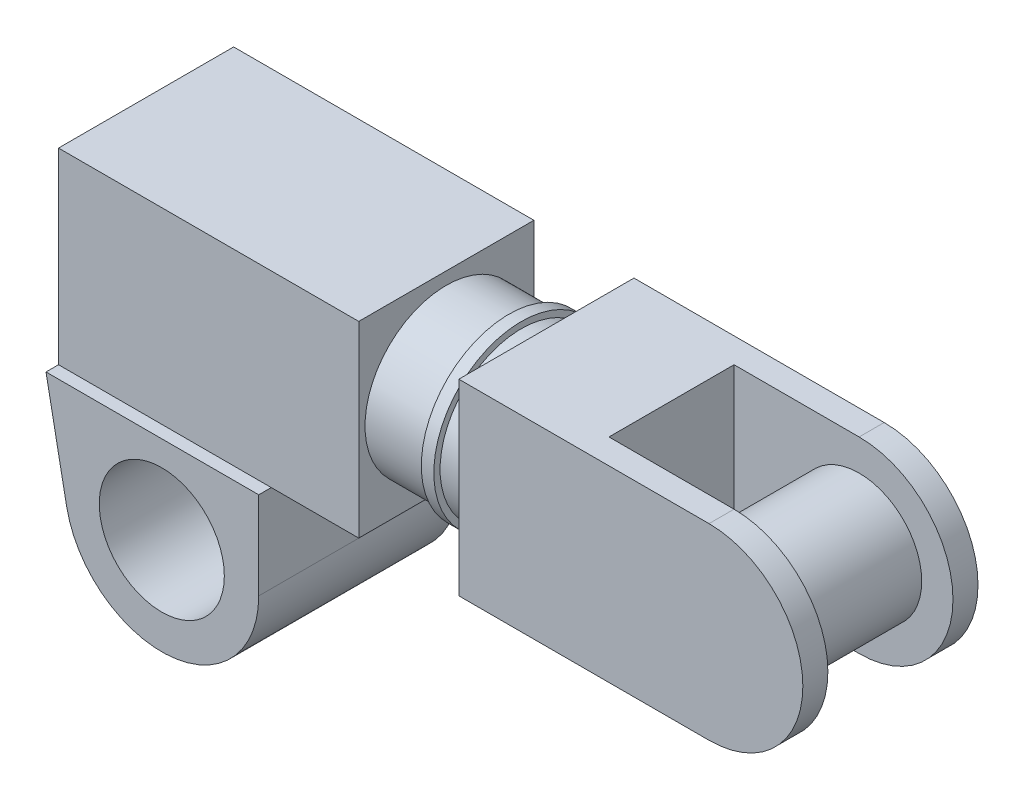
from build123d import *

# Parameters (mm, degrees)
SKETCH1_W           = 140
SKETCH1_H           = 150
BOSS_EXTRUDE1_DEPTH = 240
SKETCH2_R           = 65
BOSS_EXTRUDE2_DEPTH = 50
SKETCH3_R           = 70
BOSS_EXTRUDE3_DEPTH = 10
SKETCH4_R           = 50
BOSS_EXTRUDE4_DEPTH = 80
SKETCH5_R           = 65
BOSS_EXTRUDE5_DEPTH = 20
BOSS_EXTRUDE6_DEPTH = 70
CUT_EXTRUDE1_DEPTH  = 50
BOSS_EXTRUDE7_REACH = 650.407
SKETCH8_R           = 50


with BuildPart() as part:
    # Sketch1 → Boss-Extrude1 (new body)
    with BuildSketch(Plane(origin=(0, 0, 0), x_dir=(0, 0, -1), z_dir=(1, 0, 0))):
        Rectangle(SKETCH1_W, SKETCH1_H)
    extrude(amount=BOSS_EXTRUDE1_DEPTH)

    # Sketch2 → Boss-Extrude2 (add)
    with BuildSketch(Plane(origin=(240, 0, 0), x_dir=(0, 0, -1), z_dir=(1, 0, 0))):
        Circle(SKETCH2_R)
    extrude(amount=BOSS_EXTRUDE2_DEPTH)

    # Sketch3 → Boss-Extrude3 (add)
    with BuildSketch(Plane(origin=(290, 0, 0), x_dir=(0, 0, -1), z_dir=(1, 0, 0))):
        Circle(SKETCH3_R)
    extrude(amount=BOSS_EXTRUDE3_DEPTH)

    # Sketch4 → Boss-Extrude4 (add, symmetric)
    with BuildSketch(Plane.XY):
        with BuildLine():
            Line((0, -75), (16.481058781, -159.787697142))
            ThreePointArc((16.481058781, -159.787697142), (99.985211319, -222.143205373), (170.057165499, -145))
            Line((170.057165499, -145), (170.057165499, -75))
            Line((170.057165499, -75), (0, -75))
        make_face()
        with Locations((92.557165499, -145)):
            Circle(SKETCH4_R, mode=Mode.SUBTRACT)
    extrude(amount=BOSS_EXTRUDE4_DEPTH, both=True)

    # Sketch5 → Boss-Extrude5 (add)
    with BuildSketch(Plane(origin=(300, 0, 0), x_dir=(0, 0, -1), z_dir=(1, 0, 0))):
        Circle(SKETCH5_R)
    extrude(amount=BOSS_EXTRUDE5_DEPTH)

    # Sketch6 → Boss-Extrude6 (add, symmetric)
    with BuildSketch(Plane.XY):
        with BuildLine():
            Line((520, 75), (320, 75))
            Line((320, 75), (320, -75))
            Line((320, -75), (520, -75))
            ThreePointArc((520, -75), (595, 0), (520, 75))
        make_face()
    extrude(amount=BOSS_EXTRUDE6_DEPTH, both=True)

    # Sketch7 → Cut-Extrude1 (cut, symmetric)
    with BuildSketch(Plane.XY):
        with BuildLine():
            Line((520, 75), (420, 75))
            Line((420, 75), (420, -75))
            Line((420, -75), (520, -75))
            ThreePointArc((520, -75), (595, 0), (520, 75))
        make_face()
    extrude(amount=CUT_EXTRUDE1_DEPTH, both=True, mode=Mode.SUBTRACT)

    # Sketch8 → Boss-Extrude7 (add, up to next)
    with BuildSketch(Plane.XY.offset(-50), mode=Mode.PRIVATE) as boss_extrude7_sk1:
        with Locations((520, 0)):
            Circle(SKETCH8_R)
    boss_extrude7_tool1 = extrude(boss_extrude7_sk1.sketch, amount=BOSS_EXTRUDE7_REACH, mode=Mode.PRIVATE) - part.part
    add(boss_extrude7_tool1.solids().sort_by_distance((520, 0, -50))[0])


with BuildPart() as body_2:
    # Split1: the piece on the far side of the plane
    add(part.part)
    split(bisect_by=Plane(origin=(240, 0, 0), x_dir=(0, 0, 1), z_dir=(1, 0, 0)), keep=Keep.BOTTOM)


with BuildPart() as part_1:
    add(part.part)

    # Split1
    split(bisect_by=Plane(origin=(240, 0, 0), x_dir=(0, 0, 1), z_dir=(1, 0, 0)), keep=Keep.TOP)


solid = Compound([body_2.part, part_1.part])
